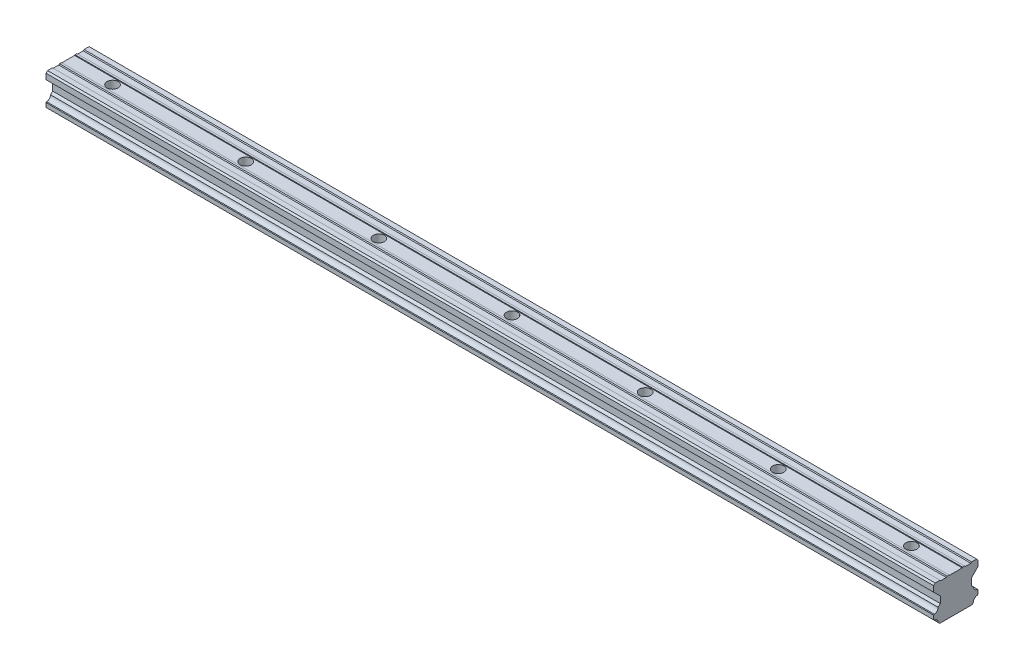
from build123d import *

# Parameters (mm, degrees)
BOSS_EXTRUDE1_DEPTH = 400
HOLE1_D             = 5
HOLE1_CBORE_D       = 9
HOLE1_CBORE_DEPTH   = 8.5
LPATTERN1_COUNT     = 7
LPATTERN1_PITCH     = 60


with BuildPart() as part:
    # Sketch1 → Boss-Extrude1 (new body)
    with BuildSketch(Plane(origin=(0, 0, 0), x_dir=(0, 0, -1), z_dir=(1, 0, 0))):
        with BuildLine():
            Line((-7.965754986, -7.693975449), (-7.266272068, -8.393458366))
            Line((-7.266272068, -8.393458366), (7.266272068, -8.393458366))
            Line((7.266272068, -8.393458366), (7.965754986, -7.693975449))
            ThreePointArc((7.965754986, -7.693975449), (8.474723757, -6.421557866), (9.747437917, -5.913331162))
            Line((9.747437917, -5.913331162), (10.000000437, -5.660768637))
            Line((10.000000437, -5.660768637), (10.000000437, -3.788406023))
            Line((10.000000437, -3.788406023), (9.747437912, -3.535843503))
            ThreePointArc((9.747437912, -3.535843503), (8.462742055, -3.016656911), (7.965755402, -1.72321096))
            Line((7.965755402, -1.72321096), (7.005148341, -0.762603918))
            Line((7.005148341, -0.762603918), (7.005148341, 2.166206023))
            Line((7.005148341, 2.166206023), (10.000000347, 5.161058089))
            Line((10.000000347, 5.161058089), (10.000000347, 7.712387211))
            Line((10.000000347, 7.712387211), (9.408464779, 8.393458268))
            Line((9.408464779, 8.393458268), (7.133016457, 8.393458268))
            Line((7.133016457, 8.393458268), (6.789534443, 8.049976247))
            Line((6.789534443, 8.049976247), (4.271139656, 8.049976247))
            Line((4.271139656, 8.049976247), (3.927707784, 8.393458265))
            Line((3.927707784, 8.393458265), (3.061282509, 8.393458265))
            Line((3.061282509, 8.393458265), (2.872049327, 8.204225079))
            Line((2.872049327, 8.204225079), (-2.87204886, 8.204225079))
            Line((-2.87204886, 8.204225079), (-3.061282046, 8.393458261))
            Line((-3.061282046, 8.393458261), (-3.927707321, 8.393458261))
            Line((-3.927707321, 8.393458261), (-4.271189216, 8.049976359))
            Line((-4.271189216, 8.049976359), (-6.789534095, 8.049976359))
            Line((-6.789534095, 8.049976359), (-7.133016116, 8.393458373))
            Line((-7.133016116, 8.393458373), (-9.30771733, 8.393458373))
            Line((-9.30771733, 8.393458373), (-10, 7.70117569))
            Line((-10, 7.70117569), (-10, 5.161058187))
            Line((-10, 5.161058187), (-7.005147934, 2.166206181))
            Line((-7.005147934, 2.166206181), (-7.005147934, -0.76260376))
            Line((-7.005147934, -0.76260376), (-7.965754986, -1.723210812))
            ThreePointArc((-7.965754986, -1.723210812), (-8.462741848, -3.016656549), (-9.747437477, -3.535843372))
            Line((-9.747437477, -3.535843372), (-10, -3.788405895))
            Line((-10, -3.788405895), (-10, -5.660768509))
            Line((-10, -5.660768509), (-9.747437477, -5.913331032))
            ThreePointArc((-9.747437477, -5.913331032), (-8.474723558, -6.421557943), (-7.965754986, -7.693975449))
        make_face()
    extrude(amount=BOSS_EXTRUDE1_DEPTH)

    # Hole1 (through all)
    with Locations(Plane(origin=(20, -8.393458366, 0), x_dir=(0, 0, -1), z_dir=(0, -1, 0))):
        with Locations((0, 0)):
            hole1 = CounterBoreHole(HOLE1_D / 2, HOLE1_CBORE_D / 2, HOLE1_CBORE_DEPTH)

    # LPattern1: Hole1 ×7
    with Locations(*[(i * LPATTERN1_PITCH, 0, 0) for i in range(1, LPATTERN1_COUNT)]):
        add(hole1, mode=Mode.SUBTRACT)


solid = part.part
